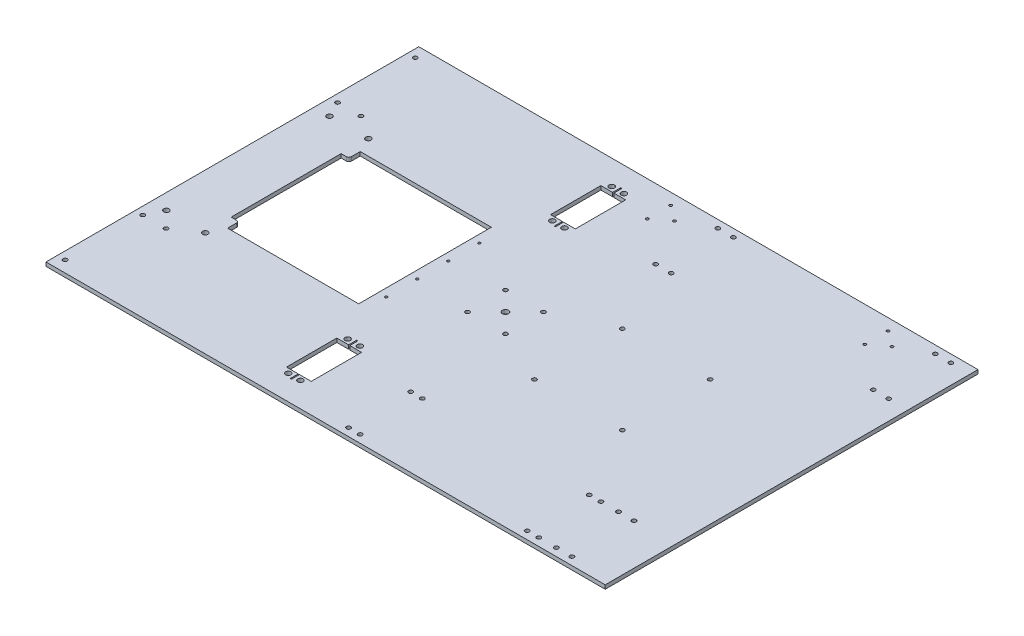
from build123d import *

# Parameters (mm, degrees)
SKETCH1_W           = 457.2
SKETCH1_H           = 304.8
BOSS_EXTRUDE1_DEPTH = 3.175
SKETCH2_R           = 2.200000045
CUT_EXTRUDE1_DEPTH  = 275.761352131
CUT_EXTRUDE2_REACH  = 276.761
SKETCH5_R           = 1.700000029
CUT_EXTRUDE3_DEPTH  = 275.761352131
SKETCH7_R           = 2.200000045
CUT_EXTRUDE5_DEPTH  = 275.761352131
SKETCH8_R           = 1.000000032
CUT_EXTRUDE6_DEPTH  = 275.761352131
SKETCH12_R          = 1.700000029
CUT_EXTRUDE7_DEPTH  = 275.761352131
SKETCH13_R          = 1.700000029
SKETCH13_R_2        = 1.127000032
CUT_EXTRUDE8_DEPTH  = 275.761352131
SKETCH14_R          = 1.700000029
SKETCH14_R_2        = 2.499999953
CUT_EXTRUDE9_DEPTH  = 275.761352131


with BuildPart() as part:
    # Sketch1 → Boss-Extrude1 (new body)
    with BuildSketch(Plane(origin=(0, 0, 0), x_dir=(1, 0, 0), z_dir=(0, 1, 0))):
        Rectangle(SKETCH1_W, SKETCH1_H)
    extrude(amount=BOSS_EXTRUDE1_DEPTH)

    # Sketch2 → Cut-Extrude1 (cut, through all)
    with BuildSketch(Plane(origin=(0, 3.175, 0), x_dir=(1, 0, 0), z_dir=(0, 1, 0))):
        with Locations((-184.15, -66.675)):
            Circle(SKETCH2_R)
        with Locations((-215.9, -66.675)):
            Circle(SKETCH2_R)
        with Locations((-184.15, 66.675)):
            Circle(SKETCH2_R)
        with Locations((-215.9, 66.675)):
            Circle(SKETCH2_R)
    extrude(amount=-CUT_EXTRUDE1_DEPTH, mode=Mode.SUBTRACT)

    # Sketch4 → Cut-Extrude2 (cut, up to next)
    with BuildSketch(Plane(origin=(0, 3.175, 0), x_dir=(1, 0, 0), z_dir=(0, 1, 0)), mode=Mode.PRIVATE) as cut_extrude2_sk1:
        with BuildLine():
            Line((-184.658, 44.958), (-184.658, -44.958))
            Line((-184.658, -44.958), (-180.34, -44.958))
            ThreePointArc((-180.34, -44.958), (-178.903159021, -45.553159021), (-178.308, -46.99))
            Line((-178.308, -46.99), (-178.308, -54.229))
            Line((-178.308, -54.229), (-71.12, -54.229))
            Line((-71.12, -54.229), (-71.12, 54.229))
            Line((-71.12, 54.229), (-178.308, 54.229))
            Line((-178.308, 54.229), (-178.308, 46.99))
            ThreePointArc((-178.308, 46.99), (-178.903159021, 45.553159021), (-180.34, 44.958))
            Line((-180.34, 44.958), (-184.658, 44.958))
        make_face()
    cut_extrude2_tool1 = extrude(cut_extrude2_sk1.sketch, amount=-CUT_EXTRUDE2_REACH, mode=Mode.PRIVATE) & part.part
    add(cut_extrude2_tool1.solids().sort_by_distance((-127.379078, 3.175, 0))[0], mode=Mode.SUBTRACT)

    # Sketch5 → Cut-Extrude3 (cut, through all)
    with BuildSketch(Plane(origin=(0, 3.175, 0), x_dir=(1, 0, 0), z_dir=(0, 1, 0))):
        with Locations((-203.2, 79.629)):
            Circle(SKETCH5_R)
        with Locations((-222.25, 143.129)):
            Circle(SKETCH5_R)
        with Locations((-222.25, 79.629)):
            Circle(SKETCH5_R)
        with Locations((-203.2, -79.629)):
            Circle(SKETCH5_R)
        with Locations((-222.25, -79.629)):
            Circle(SKETCH5_R)
        with Locations((-222.25, -143.129)):
            Circle(SKETCH5_R)
    extrude(amount=-CUT_EXTRUDE3_DEPTH, mode=Mode.SUBTRACT)

    # Sketch7 → Cut-Extrude5 (cut, through all)
    with BuildSketch(Plane(origin=(0, 3.175, 0), x_dir=(1, 0, 0), z_dir=(0, 1, 0))):
        with Locations((-50.720000033, -132.250000041)):
            Circle(SKETCH7_R)
        with Locations((-40.719999967, -132.250000041)):
            Circle(SKETCH7_R)
        with Locations((-50.720000033, -83.649999959)):
            Circle(SKETCH7_R)
        with Locations((-40.719999967, -83.649999959)):
            Circle(SKETCH7_R)
        Polygon((-55.846999939, -87.373000006), (-46.22, -87.373000006), (-46.22, -80.769000006), (-45.22, -80.769000006), (-45.22, -87.373000006), (-35.593000061, -87.373000006), (-35.593000061, -128.526999994), (-45.22, -128.526999994), (-45.22, -135.130999994), (-46.22, -135.130999994), (-46.22, -128.526999994), (-55.846999939, -128.526999994), align=None)
    cut_extrude5 = extrude(amount=-CUT_EXTRUDE5_DEPTH, mode=Mode.SUBTRACT)

    # Mirror1: Cut-Extrude5 across plane
    add(cut_extrude5.mirror(Plane.XY), mode=Mode.SUBTRACT)

    # Sketch8 → Cut-Extrude6 (cut, through all)
    with BuildSketch(Plane(origin=(0, 3.175, 0), x_dir=(1, 0, 0), z_dir=(0, 1, 0))):
        with Locations((-64.77, -38.1)):
            Circle(SKETCH8_R)
        with Locations((-64.77, -12.7)):
            Circle(SKETCH8_R)
        with Locations((-64.77, 12.7)):
            Circle(SKETCH8_R)
        with Locations((-64.77, 38.1)):
            Circle(SKETCH8_R)
    extrude(amount=-CUT_EXTRUDE6_DEPTH, mode=Mode.SUBTRACT)

    # Sketch12 → Cut-Extrude7 (cut, through all)
    with BuildSketch(Plane(origin=(0, 3.175, 0), x_dir=(1, 0, 0), z_dir=(0, 1, 0))):
        with Locations((195.024, -95.25)):
            Circle(SKETCH12_R)
        with Locations((182.324, -95.25)):
            Circle(SKETCH12_R)
        with Locations((195.024, -146.05)):
            Circle(SKETCH12_R)
        with Locations((182.324, -146.05)):
            Circle(SKETCH12_R)
        with Locations((167.9575, -95.25)):
            Circle(SKETCH12_R)
        with Locations((158.4325, -95.25)):
            Circle(SKETCH12_R)
        with Locations((167.9575, -146.05)):
            Circle(SKETCH12_R)
        with Locations((158.4325, -146.05)):
            Circle(SKETCH12_R)
        with Locations((21.90749891, -146.050000036)):
            Circle(SKETCH12_R)
        with Locations((12.38249891, -146.050000036)):
            Circle(SKETCH12_R)
        with Locations((12.38249891, -95.250000036)):
            Circle(SKETCH12_R)
        with Locations((21.90749891, -95.250000036)):
            Circle(SKETCH12_R)
    extrude(amount=-CUT_EXTRUDE7_DEPTH, mode=Mode.SUBTRACT)

    # Sketch13 → Cut-Extrude8 (cut, through all)
    with BuildSketch(Plane(origin=(0, 3.175, 0), x_dir=(1, 0, 0), z_dir=(0, 1, 0))):
        with Locations((212.725, 95.25)):
            Circle(SKETCH13_R)
        with Locations((212.725, 146.05)):
            Circle(SKETCH13_R)
        with Locations((200.025, 95.25)):
            Circle(SKETCH13_R)
        with Locations((200.025, 146.05)):
            Circle(SKETCH13_R)
        with Locations((177.213, 133.477000026)):
            Circle(SKETCH13_R_2)
        with Locations((164.513, 143.002000026)):
            Circle(SKETCH13_R_2)
        with Locations((164.513, 123.952000026)):
            Circle(SKETCH13_R_2)
        with Locations((34.925, 95.25)):
            Circle(SKETCH13_R)
        with Locations((34.925, 146.05)):
            Circle(SKETCH13_R)
        with Locations((22.225, 95.25)):
            Circle(SKETCH13_R)
        with Locations((22.225, 146.05)):
            Circle(SKETCH13_R)
        with Locations((-0.587, 133.477000026)):
            Circle(SKETCH13_R_2)
        with Locations((-13.287, 143.002000026)):
            Circle(SKETCH13_R_2)
        with Locations((-13.287, 123.952000026)):
            Circle(SKETCH13_R_2)
    extrude(amount=-CUT_EXTRUDE8_DEPTH, mode=Mode.SUBTRACT)

    # Sketch14 → Cut-Extrude9 (cut, through all)
    with BuildSketch(Plane(origin=(0, 3.175, 0), x_dir=(1, 0, 0), z_dir=(0, 1, 0))):
        with Locations((54.248975516, 35.921024484)):
            Circle(SKETCH14_R)
        with Locations((126.091024484, 35.921024484)):
            Circle(SKETCH14_R)
        with Locations((54.248975516, -35.921024484)):
            Circle(SKETCH14_R)
        with Locations((126.091024484, -35.921024484)):
            Circle(SKETCH14_R)
        with Locations((-20.833999988, 15.499999988)):
            Circle(SKETCH14_R)
        with Locations((10.165999988, 15.499999988)):
            Circle(SKETCH14_R)
        with Locations((-20.833999988, -15.499999988)):
            Circle(SKETCH14_R)
        with Locations((10.165999988, -15.499999988)):
            Circle(SKETCH14_R)
        with Locations((-5.334, 0)):
            Circle(SKETCH14_R_2)
    extrude(amount=-CUT_EXTRUDE9_DEPTH, mode=Mode.SUBTRACT)


solid = part.part
